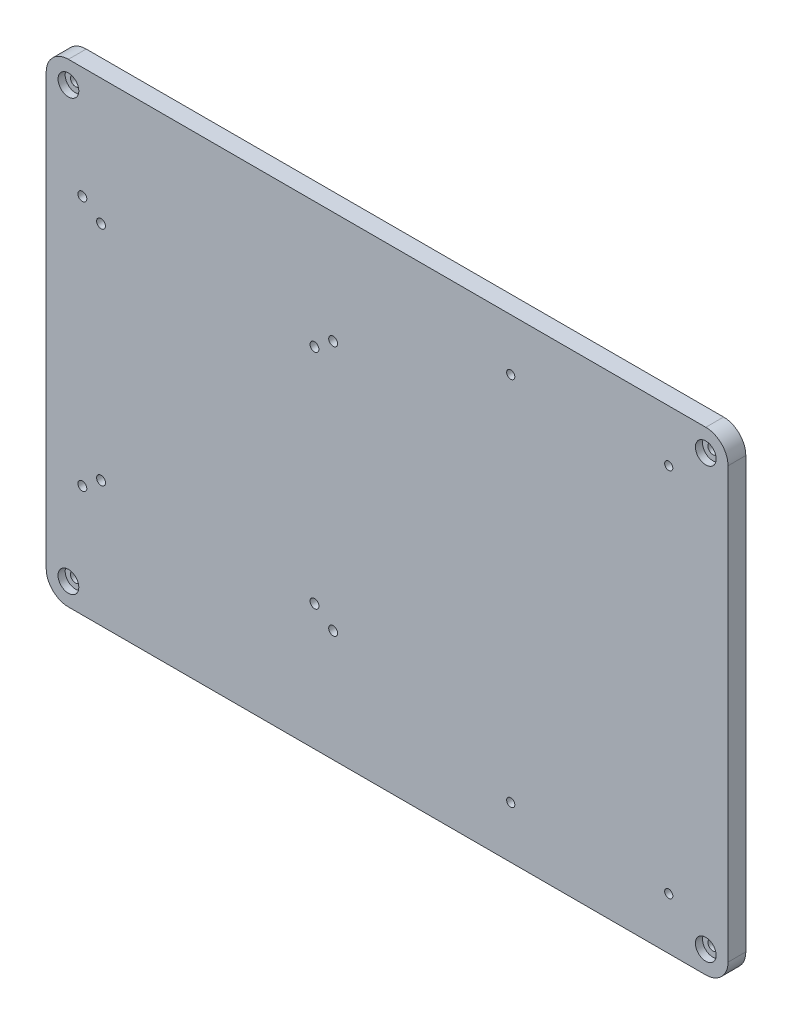
from build123d import *

# Parameters (mm, degrees)
BOSS_EXTRUDE1_DEPTH                              = 6
SKETCH4_R                                        = 1.5
CUT_EXTRUDE3_DEPTH                               = 141.2176879
CUT_EXTRUDE4_DEPTH                               = 141.2176879
CUT_EXTRUDE4_DEPTH_BACK                          = 141.2176879
SKETCH5_R                                        = 1.375
SKETCH7_R                                        = 1.5
CUT_EXTRUDE6_DEPTH                               = 141.2176879
SKETCH8_R                                        = 3
CUT_EXTRUDE7_DEPTH                               = 3.5
CBORE_FOR_M3_PAN_HEAD_MACHINE_SCREW1_D           = 3.4
CBORE_FOR_M3_PAN_HEAD_MACHINE_SCREW1_CBORE_D     = 7
CBORE_FOR_M3_PAN_HEAD_MACHINE_SCREW1_CBORE_DEPTH = 2.4


with BuildPart() as part:
    # Sketch1 → Boss-Extrude1 (new body)
    with BuildSketch(Plane.XY):
        with BuildLine():
            Line((-107.5, 80), (107.5, 80))
            ThreePointArc((107.5, 80), (112.803300859, 77.803300859), (115, 72.5))
            Line((115, 72.5), (115, -72.5))
            ThreePointArc((115, -72.5), (112.803300859, -77.803300859), (107.5, -80))
            Line((107.5, -80), (-107.5, -80))
            ThreePointArc((-107.5, -80), (-112.803300859, -77.803300859), (-115, -72.5))
            Line((-115, -72.5), (-115, 72.5))
            ThreePointArc((-115, 72.5), (-112.803300859, 77.803300859), (-107.5, 80))
        make_face()
    extrude(amount=BOSS_EXTRUDE1_DEPTH)

    # Sketch4 → Cut-Extrude3 (cut, through all)
    with BuildSketch(Plane.XY.offset(6)):
        with Locations((-96.5, 37.5)):
            Circle(SKETCH4_R)
        with Locations((-96.5, -37.5)):
            Circle(SKETCH4_R)
        with Locations((-24.5, 37.5)):
            Circle(SKETCH4_R)
        with Locations((-24.5, -37.5)):
            Circle(SKETCH4_R)
    extrude(amount=-CUT_EXTRUDE3_DEPTH, mode=Mode.SUBTRACT)

    # Sketch5 → Cut-Extrude4 (cut, two sides: drawn at the far end of the back side and taken through both)
    with BuildSketch(Plane.XY.offset(6).offset(-CUT_EXTRUDE4_DEPTH_BACK)):
        with Locations((95, -62.5)):
            Circle(SKETCH5_R)
        with Locations((95, 62.5)):
            Circle(SKETCH5_R)
        with Locations((41.7, -62.5)):
            Circle(SKETCH5_R)
        with Locations((41.7, 62.5)):
            Circle(SKETCH5_R)
    extrude(amount=CUT_EXTRUDE4_DEPTH + CUT_EXTRUDE4_DEPTH_BACK, mode=Mode.SUBTRACT)

    # Sketch7 → Cut-Extrude6 (cut, through all)
    with BuildSketch(Plane.XY.offset(6)):
        with Locations((-102.8, 42.3)):
            Circle(SKETCH7_R)
        with Locations((-102.8, -42.3)):
            Circle(SKETCH7_R)
        with Locations((-18.2, -42.3)):
            Circle(SKETCH7_R)
        with Locations((-18.2, 42.3)):
            Circle(SKETCH7_R)
    extrude(amount=-CUT_EXTRUDE6_DEPTH, mode=Mode.SUBTRACT)

    # Sketch8 → Cut-Extrude7 (cut)
    with BuildSketch(Plane(origin=(0, 0, 0), x_dir=(-1, 0, 0), z_dir=(0, 0, -1))):
        with Locations((18.2, 42.3)):
            Circle(SKETCH8_R)
        with Locations((18.2, -42.3)):
            Circle(SKETCH8_R)
        with Locations((102.8, -42.3)):
            Circle(SKETCH8_R)
        with Locations((102.8, 42.3)):
            Circle(SKETCH8_R)
    extrude(amount=-CUT_EXTRUDE7_DEPTH, mode=Mode.SUBTRACT)

    # CBORE for M3 Pan Head Machine Screw1 (through all)
    with Locations(Plane.XY.offset(6)):
        with Locations((-107.5, 72.5), (-107.5, -72.5), (107.5, -72.5), (107.5, 72.5)):
            CounterBoreHole(CBORE_FOR_M3_PAN_HEAD_MACHINE_SCREW1_D / 2, CBORE_FOR_M3_PAN_HEAD_MACHINE_SCREW1_CBORE_D / 2, CBORE_FOR_M3_PAN_HEAD_MACHINE_SCREW1_CBORE_DEPTH)


solid = part.part
